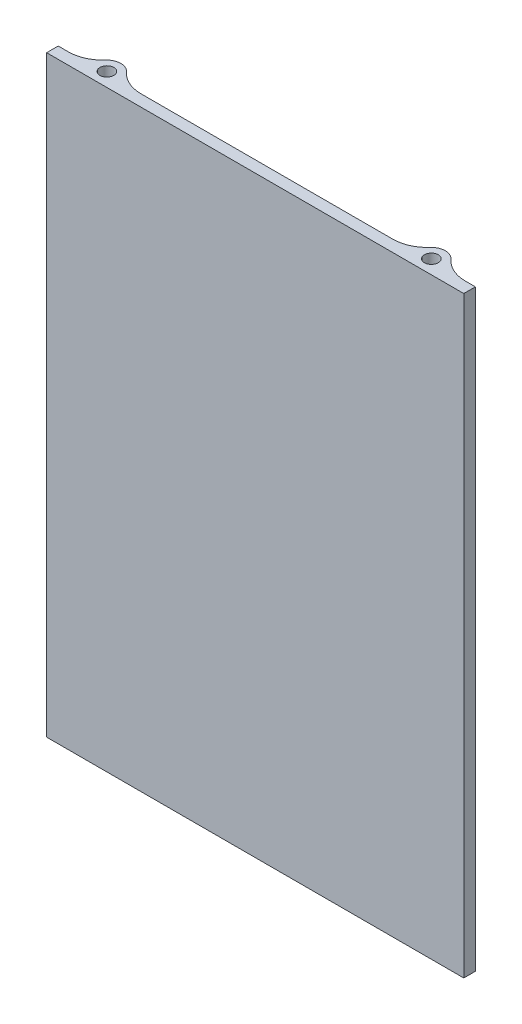
from build123d import *

# Parameters (mm, degrees)
SKETCH1_R           = 3
BOSS_EXTRUDE1_DEPTH = 255.8


with BuildPart() as part:
    # Sketch1 → Boss-Extrude1 (new body)
    with BuildSketch(Plane(origin=(0, 0, 0), x_dir=(1, 0, 0), z_dir=(0, 1, 0))):
        with BuildLine():
            Line((90, 5.5), (90, 0.5))
            Line((90, 0.5), (-90, 0.5))
            Line((-90, 0.5), (-90, 5.5))
            Line((-90, 5.5), (-85.652475842, 5.5))
            ThreePointArc((-85.652475842, 5.5), (-79.528751486, 6.806936062), (-74.472135955, 10.5))
            ThreePointArc((-74.472135955, 10.5), (-70, 12.5), (-65.527864045, 10.5))
            ThreePointArc((-65.527864045, 10.5), (-60.471248514, 6.806936062), (-54.347524158, 5.5))
            Line((-54.347524158, 5.5), (54.347524158, 5.5))
            ThreePointArc((54.347524158, 5.5), (60.471248514, 6.806936062), (65.527864045, 10.5))
            ThreePointArc((65.527864045, 10.5), (70, 12.5), (74.472135955, 10.5))
            ThreePointArc((74.472135955, 10.5), (79.528751486, 6.806936062), (85.652475842, 5.5))
            Line((85.652475842, 5.5), (90, 5.5))
        make_face()
        with Locations((-70, 6.5)):
            Circle(SKETCH1_R, mode=Mode.SUBTRACT)
        with Locations((70, 6.5)):
            Circle(SKETCH1_R, mode=Mode.SUBTRACT)
    extrude(amount=BOSS_EXTRUDE1_DEPTH)


solid = part.part
